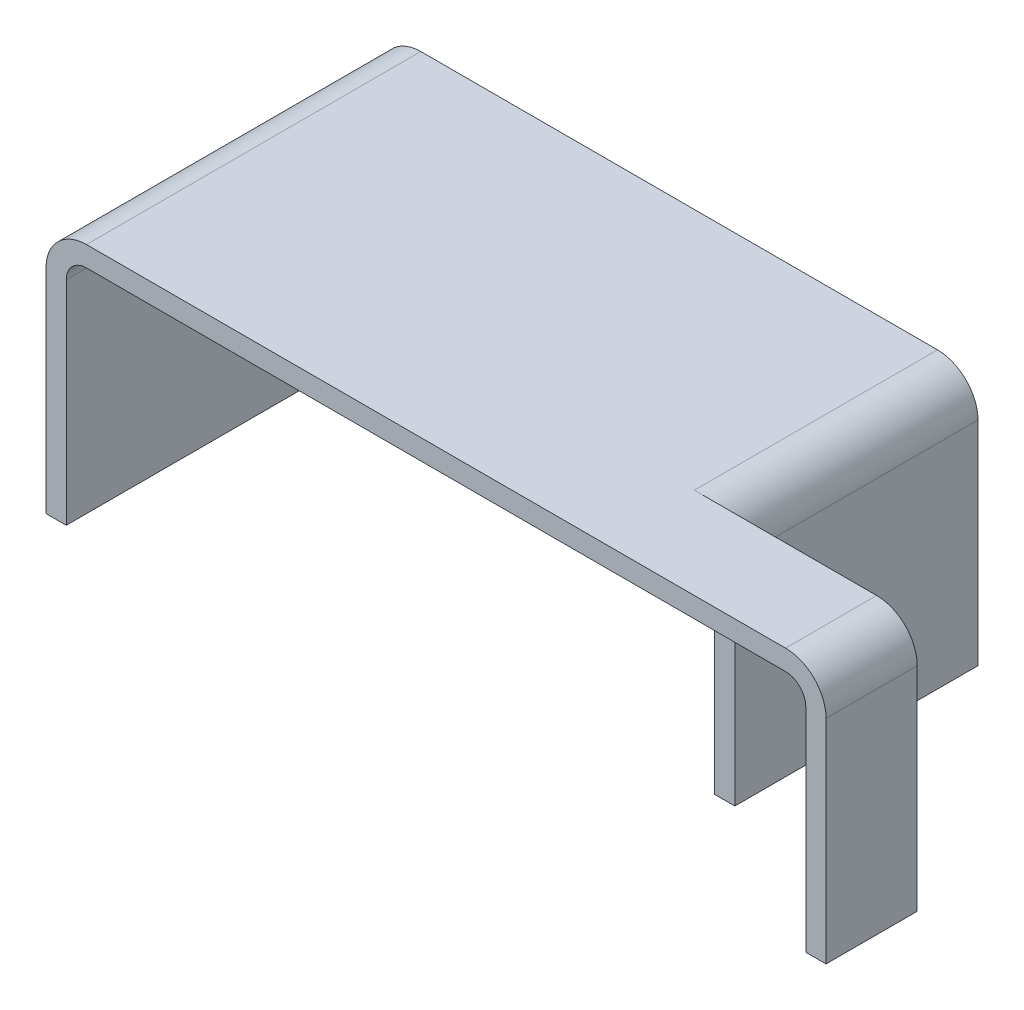
from build123d import *

# Parameters (mm, degrees)
BOSS_EXTRUDE1_DEPTH = 25
CUT_EXTRUDE1_DEPTH  = 88.424252928
CUT_EXTRUDE2_DEPTH  = 9
FILLET3_R           = 4


with BuildPart() as part:
    # Sketch1 → Boss-Extrude1 (new body)
    with BuildSketch(Plane(origin=(0, 0, 0), x_dir=(1, 0, 0), z_dir=(0, 1, 0))):
        Polygon((0, 0), (0, 33), (59, 33), (59, 9), (77, 9), (77, 0), align=None)
    extrude(amount=BOSS_EXTRUDE1_DEPTH)

    # Sketch3 → Cut-Extrude1 (cut, through all)
    with BuildSketch(Plane(origin=(0, 0, -33), x_dir=(-1, 0, 0), z_dir=(0, 0, -1))):
        with BuildLine():
            Line((-57, 0), (-2, 0))
            Line((-2, 0), (-2, 21))
            ThreePointArc((-2, 21), (-2.585786438, 22.414213562), (-4, 23))
            Line((-4, 23), (-55, 23))
            ThreePointArc((-55, 23), (-56.414213562, 22.414213562), (-57, 21))
            Line((-57, 21), (-57, 0))
        make_face()
    extrude(amount=-CUT_EXTRUDE1_DEPTH, mode=Mode.SUBTRACT)

    # Sketch4 → Cut-Extrude2 (cut)
    with BuildSketch(Plane.XY):
        with BuildLine():
            Line((75, 0), (51.080310893, 0))
            Line((51.080310893, 0), (51.080310893, 23))
            Line((51.080310893, 23), (73, 23))
            ThreePointArc((73, 23), (74.414213562, 22.414213562), (75, 21))
            Line((75, 21), (75, 0))
        make_face()
    extrude(amount=-CUT_EXTRUDE2_DEPTH, mode=Mode.SUBTRACT)

    # Fillet3
    # the kernel refuses this fillet: 4 mm, written as the material it takes off along each edge
    with BuildSketch(Plane(origin=(59, 25, -43), x_dir=(-1, 0, 0), z_dir=(0, 0, 1))) as fillet3_piece_1:
        with BuildLine():
            CenterArc((FILLET3_R, FILLET3_R), FILLET3_R, 180, 90)
            Line((0, FILLET3_R), (0, 0))
            Line((0, 0), (FILLET3_R, 0))
        make_face()
    extrude(amount=34, mode=Mode.SUBTRACT)
    with BuildSketch(Plane(origin=(0, 25, 10), x_dir=(0, -1, 0), z_dir=(0, 0, -1))) as fillet3_piece_2:
        with BuildLine():
            CenterArc((FILLET3_R, -FILLET3_R), FILLET3_R, 90, 90)
            Line((0, -FILLET3_R), (0, 0))
            Line((0, 0), (FILLET3_R, 0))
        make_face()
    extrude(amount=53, mode=Mode.SUBTRACT)
    with BuildSketch(Plane(origin=(77, 25, -19), x_dir=(-1, 0, 0), z_dir=(0, 0, 1))) as fillet3_piece_3:
        with BuildLine():
            CenterArc((FILLET3_R, FILLET3_R), FILLET3_R, 180, 90)
            Line((0, FILLET3_R), (0, 0))
            Line((0, 0), (FILLET3_R, 0))
        make_face()
    extrude(amount=29, mode=Mode.SUBTRACT)


solid = part.part
